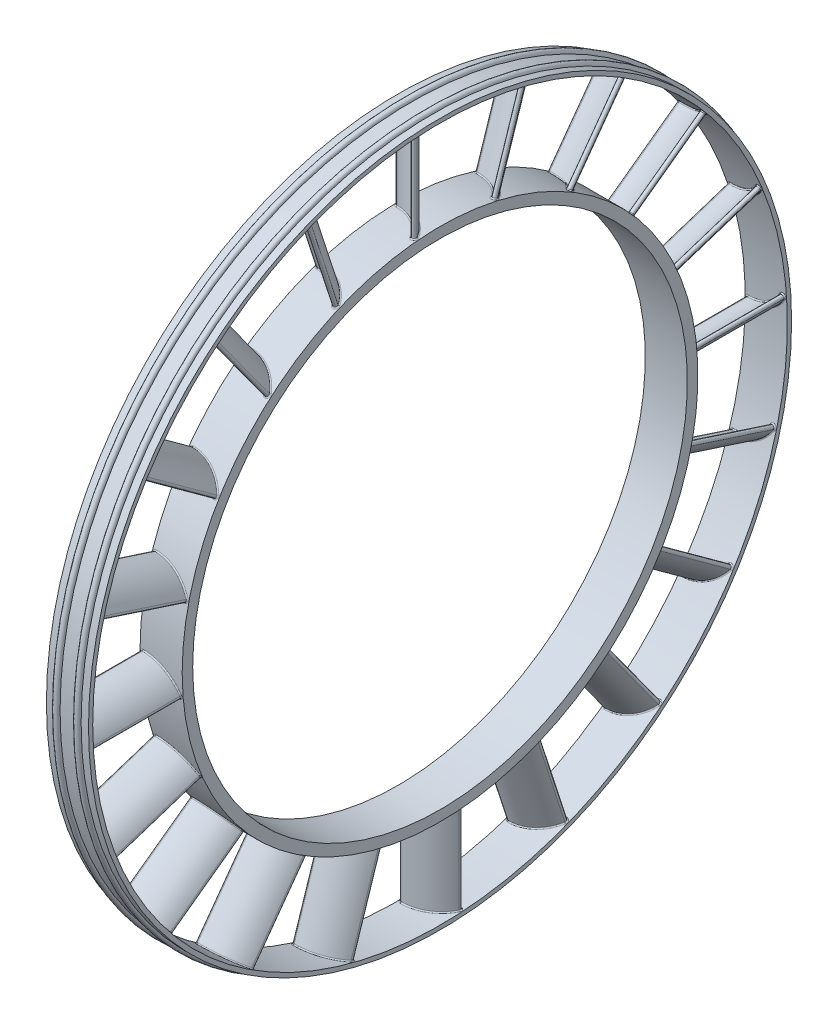
from build123d import *

# Parameters (mm, degrees)
SKETCH1_W                = 20
SKETCH1_H                = 5
BOSS_EXTRUDE1_REACH      = 359.005
BOSS_EXTRUDE1_END_RADIUS = 165
BOSS_EXTRUDE1_START      = 118.5
FILLET1_R                = 0.5
CIRPATTERN1_COUNT        = 20
FILLET1_OF_CIRPATTERN1_R = 0.5


with BuildPart() as part:
    # Sketch1 → Revolve1 (revolve)
    with BuildSketch(Plane.XY, mode=Mode.PRIVATE) as revolve1_sk:
        with Locations((0, 120)):
            Rectangle(SKETCH1_W, SKETCH1_H)
        with BuildLine():
            Line((-10, 165), (10, 165))
            Line((10, 165), (10, 167))
            Line((10, 167), (6.5, 167))
            ThreePointArc((6.5, 167), (5, 168.5), (3.5, 167))
            Line((3.5, 167), (-3.5, 167))
            ThreePointArc((-3.5, 167), (-5, 168.5), (-6.5, 167))
            Line((-6.5, 167), (-10, 167))
            Line((-10, 167), (-10, 165))
        make_face()
    revolve(revolve1_sk.sketch.rotate(Axis((-118.82812409, 0, 0), (1, 0, 0)), 90), axis=Axis((-118.82812409, 0, 0), (1, 0, 0)))

    # Boss-Extrude1: up to this cylinder (the profile starts inside it)
    boss_extrude1_end = Plane(origin=(0.611719, 0, 0), z_dir=(-1, 0, 0)) * Cylinder(BOSS_EXTRUDE1_END_RADIUS, 1049.01, mode=Mode.PRIVATE)
    # Sketch2 → Boss-Extrude1 (add, up to the surface)
    with BuildSketch(Plane(origin=(0, 0, 0), x_dir=(1, 0, 0), z_dir=(0, 1, 0)).offset(BOSS_EXTRUDE1_START), mode=Mode.PRIVATE) as boss_extrude1_sk1:
        with BuildLine():
            ThreePointArc((-8.5, 0), (1.601808083, -2.634335854), (9, -10))
            ThreePointArc((9, -10), (8.633911401, -11.366008469), (7.267902932, -10.99991987))
            ThreePointArc((7.267902932, -10.99991987), (0.609530207, -4.370822138), (-8.482097068, -1.99991987))
            ThreePointArc((-8.482097068, -1.99991987), (-9.491008469, -1.008911401), (-8.5, 0))
        make_face()
    boss_extrude1_tool1 = extrude(boss_extrude1_sk1.sketch, amount=BOSS_EXTRUDE1_REACH, mode=Mode.PRIVATE) & boss_extrude1_end
    boss_extrude1 = boss_extrude1_tool1.solids().sort_by_distance((0.611719, 118.5, 4.366992))[0]
    add(boss_extrude1)

    # Fillet1
    fillet1_edges = [part.edges().sort_by_distance(p)[0] for p in [
        (1.605453184, 122.471626513, 2.636419283),
        (8.635268848, 121.971643, 11.365223446),
        (0.613993285, 122.421908219, 4.373373321),
        (-9.491008272, 122.495845046, 1.008933313),
        (-9.49100836, 164.996915345, 1.008923477),
        (0.611985417, 164.942061502, 4.372225376),
        (8.634658324, 164.608091123, 11.365576835),
        (1.603814117, 164.978950904, 2.635482318),
    ]]
    fillet(fillet1_edges, radius=FILLET1_R)

    # CirPattern1: Boss-Extrude1 ×20 about axis
    cirpattern1_axis = Axis((-118.82812409, 0, 0), (-1, 0, 0))
    for i in range(1, CIRPATTERN1_COUNT):
        add(boss_extrude1.rotate(cirpattern1_axis, i * 360 / CIRPATTERN1_COUNT))

    # Fillet1 of CirPattern1
    fillet1_of_cirpattern1_edges = [part.edges().sort_by_distance(p)[0] for p in [
        (1.605453184, 117.292136819, -35.338430182),
        (8.635268848, 119.513973068, -26.882340701),
        (0.613993285, 117.781600228, -33.671124929),
        (-9.491008272, 116.81224919, -36.893745258),
        (-9.49100836, 157.233166008, -50.027307614),
        (0.611985417, 158.220314347, -46.811666657),
        (8.634658324, 160.063754091, -40.057391658),
        (1.603814117, 157.718715134, -48.474806911),
        (1.605453184, 100.631275551, -69.854107884),
        (8.635268848, 105.35744275, -62.498474041),
        (0.613993285, 101.612008574, -68.41965887),
        (-9.491008272, 99.694256504, -71.185006989),
        (-9.49100836, 134.078338874, -96.166517275),
        (0.611985417, 136.010860437, -93.413306601),
        (8.634658324, 139.851261578, -87.559263559),
        (1.603814117, 135.019872635, -94.840044297),
        (1.605453184, 74.119923893, -97.531978804),
        (8.635268848, 80.887791866, -91.996821288),
        (0.613993285, 75.495925548, -96.470799893),
        (-9.491008272, 72.817495381, -98.508184261),
        (-9.49100836, 97.798989753, -132.892278193),
        (0.611985417, 100.487715865, -130.871001247),
        (8.634658324, 105.949153181, -126.490224683),
        (1.603814117, 99.104344264, -131.921677356),
        (1.605453184, 40.35319766, -115.662740093),
        (8.635268848, 48.500280337, -112.489878689),
        (0.613993285, 41.989775318, -115.07870687),
        (-9.491008272, 38.812850461, -116.188694111),
        (-9.49100836, 51.946394108, -156.609617007),
        (0.611985417, 55.128133525, -155.518130458),
        (8.634658324, 61.676003479, -153.039441305),
        (1.603814117, 53.487792176, -156.089897484),
        (1.605453184, 2.636419283, -122.471626513),
        (8.635268848, 11.365223446, -121.971643),
        (0.613993285, 4.373373321, -122.421908219),
        (-9.491008272, 1.008933313, -122.495845046),
        (-9.49100836, 1.008923477, -164.996915345),
        (0.611985417, 4.372225376, -164.942061502),
        (8.634658324, 11.365576835, -164.608091123),
        (1.603814117, 2.635482318, -164.978950904),
        (1.605453184, -35.338430182, -117.292136819),
        (8.635268848, -26.882340701, -119.513973068),
        (0.613993285, -33.671124929, -117.781600228),
        (-9.491008272, -36.893745258, -116.81224919),
        (-9.49100836, -50.027307614, -157.233166008),
        (0.611985417, -46.811666657, -158.220314347),
        (8.634658324, -40.057391658, -160.063754091),
        (1.603814117, -48.474806911, -157.718715134),
        (1.605453184, -69.854107884, -100.631275551),
        (8.635268848, -62.498474041, -105.35744275),
        (0.613993285, -68.41965887, -101.612008574),
        (-9.491008272, -71.185006989, -99.694256504),
        (-9.49100836, -96.166517275, -134.078338874),
        (0.611985417, -93.413306601, -136.010860437),
        (8.634658324, -87.559263559, -139.851261578),
        (1.603814117, -94.840044297, -135.019872635),
        (1.605453184, -97.531978804, -74.119923893),
        (8.635268848, -91.996821288, -80.887791866),
        (0.613993285, -96.470799893, -75.495925548),
        (-9.491008272, -98.508184261, -72.817495381),
        (-9.49100836, -132.892278193, -97.798989753),
        (0.611985417, -130.871001247, -100.487715865),
        (8.634658324, -126.490224683, -105.949153181),
        (1.603814117, -131.921677356, -99.104344264),
        (1.605453184, -115.662740093, -40.35319766),
        (8.635268848, -112.489878689, -48.500280337),
        (0.613993285, -115.07870687, -41.989775318),
        (-9.491008272, -116.188694111, -38.812850461),
        (-9.49100836, -156.609617007, -51.946394108),
        (0.611985417, -155.518130458, -55.128133525),
        (8.634658324, -153.039441305, -61.676003479),
        (1.603814117, -156.089897484, -53.487792176),
        (1.605453184, -122.471626513, -2.636419283),
        (8.635268848, -121.971643, -11.365223446),
        (0.613993285, -122.421908219, -4.373373321),
        (-9.491008272, -122.495845046, -1.008933313),
        (-9.49100836, -164.996915345, -1.008923477),
        (0.611985417, -164.942061502, -4.372225376),
        (8.634658324, -164.608091123, -11.365576835),
        (1.603814117, -164.978950904, -2.635482318),
        (1.605453184, -117.292136819, 35.338430182),
        (8.635268848, -119.513973068, 26.882340701),
        (0.613993285, -117.781600228, 33.671124929),
        (-9.491008272, -116.81224919, 36.893745258),
        (-9.49100836, -157.233166008, 50.027307614),
        (0.611985417, -158.220314347, 46.811666657),
        (8.634658324, -160.063754091, 40.057391658),
        (1.603814117, -157.718715134, 48.474806911),
        (1.605453184, -100.631275551, 69.854107884),
        (8.635268848, -105.35744275, 62.498474041),
        (0.613993285, -101.612008574, 68.41965887),
        (-9.491008272, -99.694256504, 71.185006989),
        (-9.49100836, -134.078338874, 96.166517275),
        (0.611985417, -136.010860437, 93.413306601),
        (8.634658324, -139.851261578, 87.559263559),
        (1.603814117, -135.019872635, 94.840044297),
        (1.605453184, -74.119923893, 97.531978804),
        (8.635268848, -80.887791866, 91.996821288),
        (0.613993285, -75.495925548, 96.470799893),
        (-9.491008272, -72.817495381, 98.508184261),
        (-9.49100836, -97.798989753, 132.892278193),
        (0.611985417, -100.487715865, 130.871001247),
        (8.634658324, -105.949153181, 126.490224683),
        (1.603814117, -99.104344264, 131.921677356),
        (1.605453184, -40.35319766, 115.662740093),
        (8.635268848, -48.500280337, 112.489878689),
        (0.613993285, -41.989775318, 115.07870687),
        (-9.491008272, -38.812850461, 116.188694111),
        (-9.49100836, -51.946394108, 156.609617007),
        (0.611985417, -55.128133525, 155.518130458),
        (8.634658324, -61.676003479, 153.039441305),
        (1.603814117, -53.487792176, 156.089897484),
        (1.605453184, -2.636419283, 122.471626513),
        (8.635268848, -11.365223446, 121.971643),
        (0.613993285, -4.373373321, 122.421908219),
        (-9.491008272, -1.008933313, 122.495845046),
        (-9.49100836, -1.008923477, 164.996915345),
        (0.611985417, -4.372225376, 164.942061502),
        (8.634658324, -11.365576835, 164.608091123),
        (1.603814117, -2.635482318, 164.978950904),
        (1.605453184, 35.338430182, 117.292136819),
        (8.635268848, 26.882340701, 119.513973068),
        (0.613993285, 33.671124929, 117.781600228),
        (-9.491008272, 36.893745258, 116.81224919),
        (-9.49100836, 50.027307614, 157.233166008),
        (0.611985417, 46.811666657, 158.220314347),
        (8.634658324, 40.057391658, 160.063754091),
        (1.603814117, 48.474806911, 157.718715134),
        (1.605453184, 69.854107884, 100.631275551),
        (8.635268848, 62.498474041, 105.35744275),
        (0.613993285, 68.41965887, 101.612008574),
        (-9.491008272, 71.185006989, 99.694256504),
        (-9.49100836, 96.166517275, 134.078338874),
        (0.611985417, 93.413306601, 136.010860437),
        (8.634658324, 87.559263559, 139.851261578),
        (1.603814117, 94.840044297, 135.019872635),
        (1.605453184, 97.531978804, 74.119923893),
        (8.635268848, 91.996821288, 80.887791866),
        (0.613993285, 96.470799893, 75.495925548),
        (-9.491008272, 98.508184261, 72.817495381),
        (-9.49100836, 132.892278193, 97.798989753),
        (0.611985417, 130.871001247, 100.487715865),
        (8.634658324, 126.490224683, 105.949153181),
        (1.603814117, 131.921677356, 99.104344264),
        (1.605453184, 115.662740093, 40.35319766),
        (8.635268848, 112.489878689, 48.500280337),
        (0.613993285, 115.07870687, 41.989775318),
        (-9.491008272, 116.188694111, 38.812850461),
        (-9.49100836, 156.609617007, 51.946394108),
        (0.611985417, 155.518130458, 55.128133525),
        (8.634658324, 153.039441305, 61.676003479),
        (1.603814117, 156.089897484, 53.487792176),
    ]]
    fillet(fillet1_of_cirpattern1_edges, radius=FILLET1_OF_CIRPATTERN1_R)


solid = part.part
